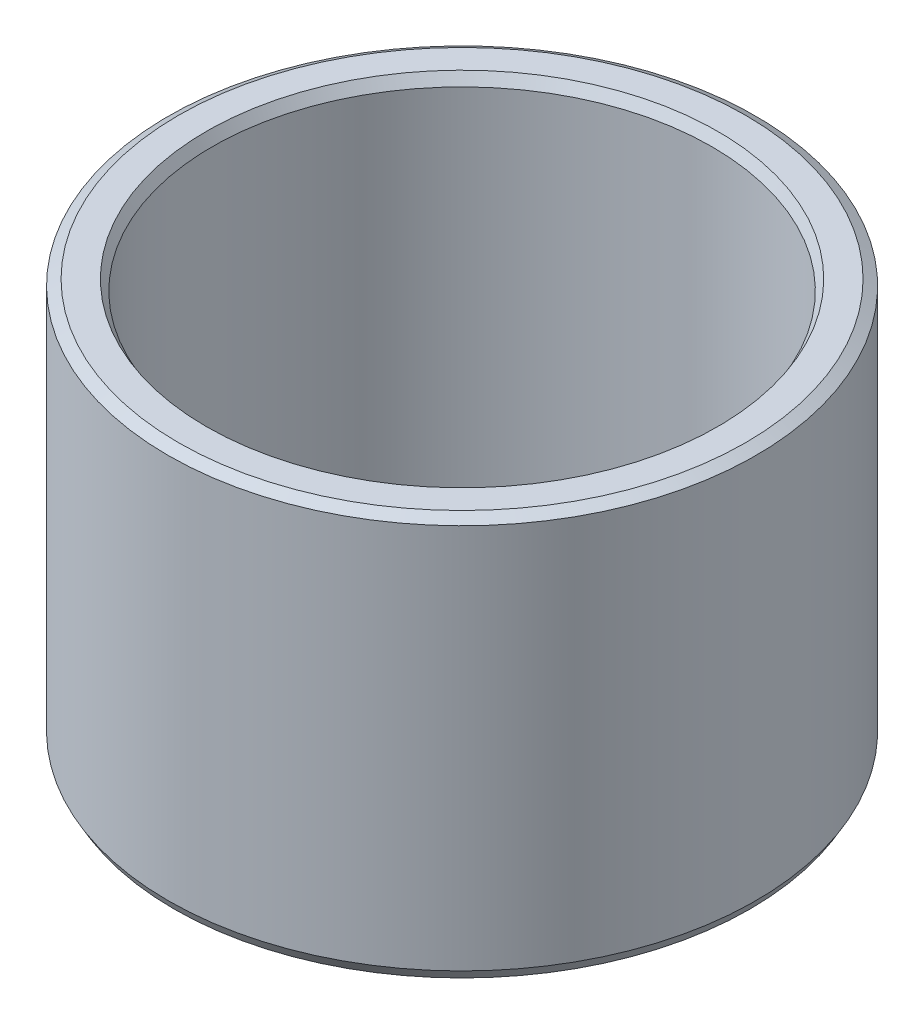
from build123d import *
from OCP.BRepFilletAPI import BRepFilletAPI_MakeChamfer

# Parameters (mm, degrees)
SKETCH1_R           = 32.5
BOSS_EXTRUDE1_DEPTH = 44.436575275
SKETCH2_R           = 27.628848974
CUT_EXTRUDE1_DEPTH  = 64.930503065
CHAMFER1_SIZE       = 0.656939561
CHAMFER1_SIZE2      = 1.137852697


with BuildPart() as part:
    # Sketch1 → Boss-Extrude1 (new body)
    with BuildSketch(Plane(origin=(0, 0, 0), x_dir=(1, 0, 0), z_dir=(0, 1, 0))):
        Circle(SKETCH1_R)
    extrude(amount=BOSS_EXTRUDE1_DEPTH)

    # Sketch2 → Cut-Extrude1 (cut, through all)
    with BuildSketch(Plane(origin=(0, 0, 0), x_dir=(1, 0, 0), z_dir=(0, 1, 0))):
        Circle(SKETCH2_R)
    extrude(amount=CUT_EXTRUDE1_DEPTH, mode=Mode.SUBTRACT)

    # Chamfer1: one chamfer whose edges measure the first distance from different faces: ONE call of the kernel's chamfer builder (chamfer() names one face for all edges)
    chamfer1_edges_1 = [part.edges().sort_by_distance(p)[0] for p in [
        (-27.628848974, 44.436575275, 0),
    ]]
    chamfer1_side_1 = [part.faces().sort_by_distance(p)[0] for p in [
        (-31.580761184, 44.436575275, 0),
    ]]
    chamfer1_edges_2 = [part.edges().sort_by_distance(p)[0] for p in [
        (-27.628848974, 0, 0),
    ]]
    chamfer1_side_2 = [part.faces().sort_by_distance(p)[0] for p in [
        (-27.628848974, 22.218287638, 0),
    ]]
    chamfer1_edges_3 = [part.edges().sort_by_distance(p)[0] for p in [
        (-32.5, 0, 0),
    ]]
    chamfer1_side_3 = [part.faces().sort_by_distance(p)[0] for p in [
        (-31.580761184, 0, 0),
    ]]
    chamfer1_edges_4 = [part.edges().sort_by_distance(p)[0] for p in [
        (-32.5, 44.436575275, 0),
    ]]
    chamfer1_side_4 = [part.faces().sort_by_distance(p)[0] for p in [
        (-32.5, 22.218287638, 0),
    ]]
    chamfer1 = BRepFilletAPI_MakeChamfer(part.part.solid().wrapped)
    for e in chamfer1_edges_1:
        chamfer1.Add(CHAMFER1_SIZE, CHAMFER1_SIZE2, e.wrapped, chamfer1_side_1[0].wrapped)  # the first distance lies on this face
    for e in chamfer1_edges_2:
        chamfer1.Add(CHAMFER1_SIZE, CHAMFER1_SIZE2, e.wrapped, chamfer1_side_2[0].wrapped)  # the first distance lies on this face
    for e in chamfer1_edges_3:
        chamfer1.Add(CHAMFER1_SIZE, CHAMFER1_SIZE2, e.wrapped, chamfer1_side_3[0].wrapped)  # the first distance lies on this face
    for e in chamfer1_edges_4:
        chamfer1.Add(CHAMFER1_SIZE, CHAMFER1_SIZE2, e.wrapped, chamfer1_side_4[0].wrapped)  # the first distance lies on this face
    add(Compound.cast(chamfer1.Shape()), mode=Mode.REPLACE)


solid = part.part
